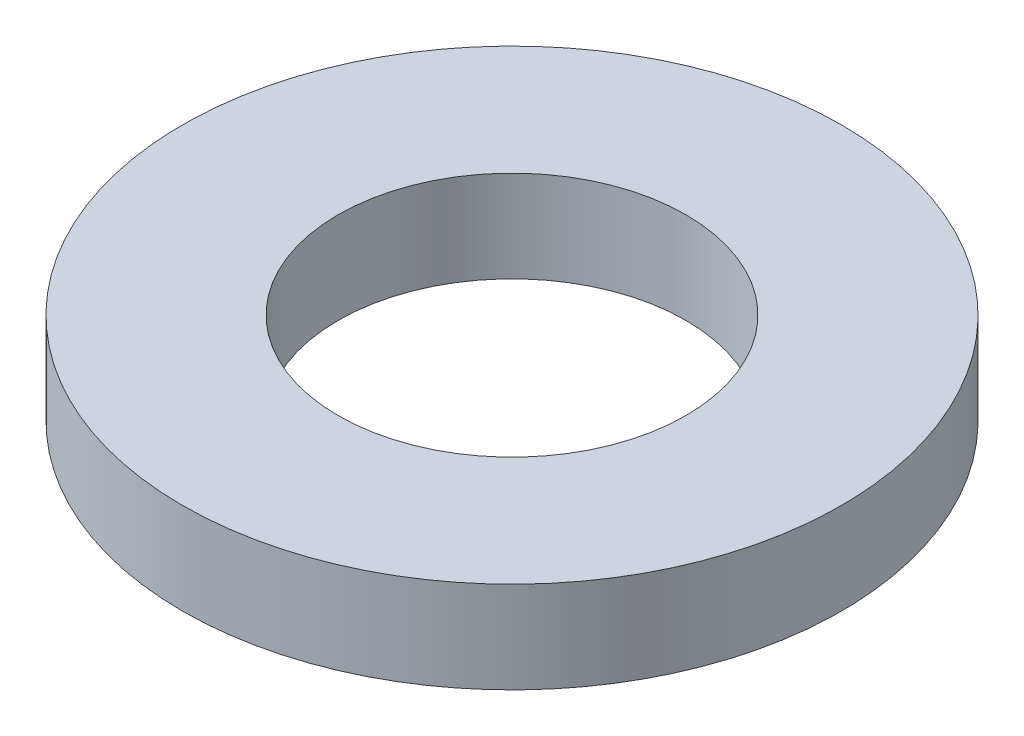
from build123d import *

# Parameters (mm, degrees)
SKETCH1_R           = 90
BOSS_EXTRUDE1_DEPTH = 25
SKETCH2_R           = 47.5
CUT_EXTRUDE1_DEPTH  = 130.711217711


with BuildPart() as part:
    # Sketch1 → Boss-Extrude1 (new body)
    with BuildSketch(Plane(origin=(0, 0, 0), x_dir=(1, 0, 0), z_dir=(0, 1, 0))):
        Circle(SKETCH1_R)
    extrude(amount=BOSS_EXTRUDE1_DEPTH)

    # Sketch2 → Cut-Extrude1 (cut, through all)
    with BuildSketch(Plane(origin=(0, 0, 0), x_dir=(1, 0, 0), z_dir=(0, 1, 0))):
        Circle(SKETCH2_R)
    extrude(amount=CUT_EXTRUDE1_DEPTH, mode=Mode.SUBTRACT)


solid = part.part
